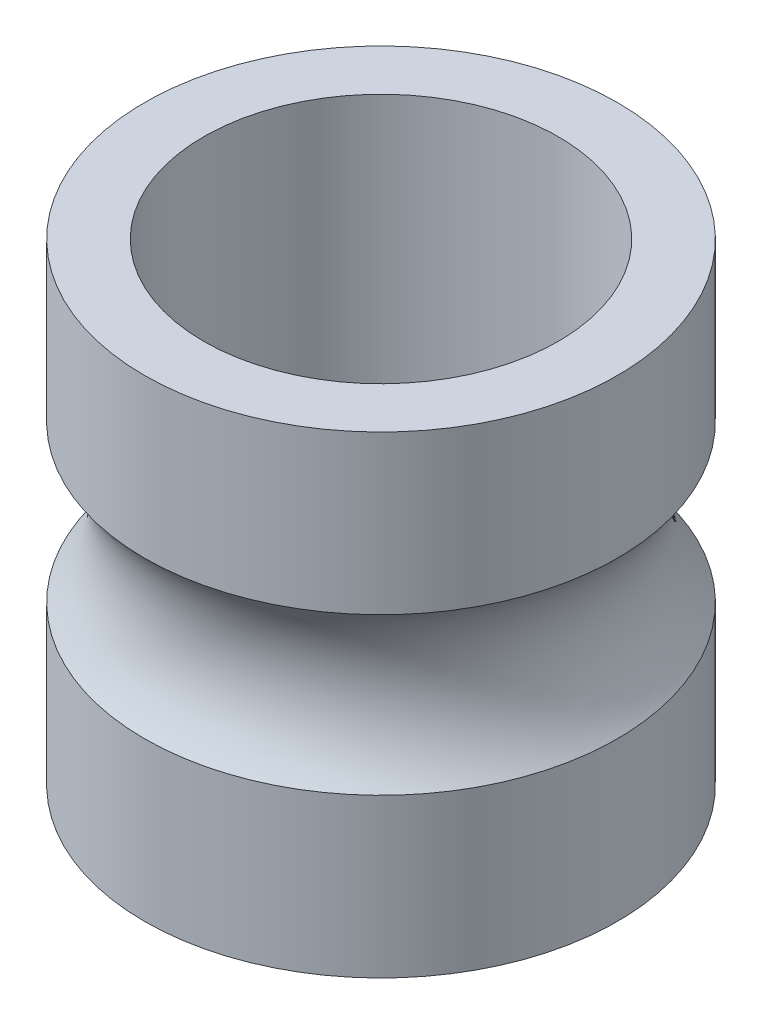
from build123d import *

# Parameters (mm, degrees)
DIAPROFILES_R         = 2
DIAPROFILES_R_2       = 1.5
DIAPROFILE_DEPTH      = 2
BEARINGPATHPROFILES_R = 1


with BuildPart() as part:
    # DiaProfileS → DiaProfile (new, symmetric)
    with BuildSketch(Plane(origin=(0, 0, 0), x_dir=(1, 0, 0), z_dir=(0, 1, 0))):
        Circle(DIAPROFILES_R)
        Circle(DIAPROFILES_R_2, mode=Mode.SUBTRACT)
    extrude(amount=DIAPROFILE_DEPTH, both=True)

    # BearingPathProfileS → BearingPathProfile (revolve, cut)
    with BuildSketch(Plane.XY):
        with Locations((2.75, 0)):
            Circle(BEARINGPATHPROFILES_R)
    revolve(axis=Axis((0, 2, 0), (0, -1, 0)), mode=Mode.SUBTRACT)


solid = part.part
